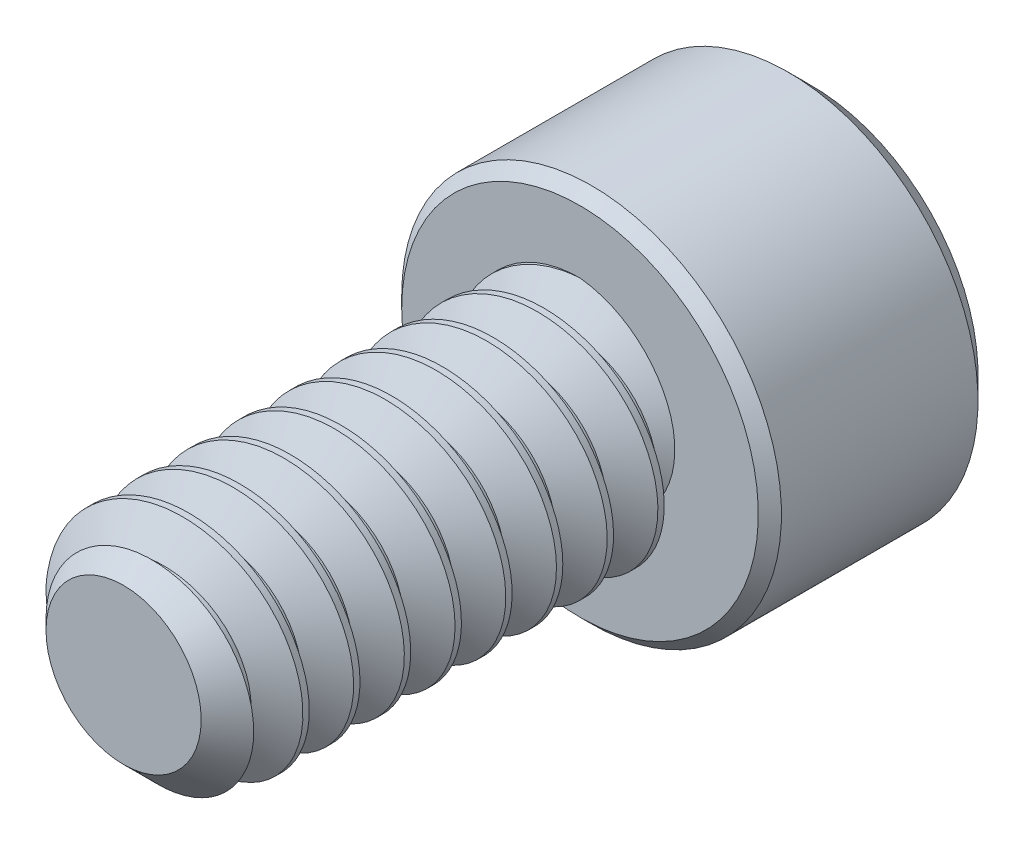
from build123d import *

# Parameters (mm, degrees)
SKETCH1_R          = 2.413
EXTRUDE1_DEPTH     = 9.525
CHAMFER3_SIZE      = 0.79375
CUT_SWEEP1_PITCH   = 1.058333333
SKETCH6_R          = 3.9624
EXTRUDE2_DEPTH     = 4.826
CUT_EXTRUDE1_DEPTH = 2.9765625
SKETCH8_R          = 2.291358881
CUT_EXTRUDE2_DEPTH = 0.4826
CUT_EXTRUDE2_DRAFT = -45
CHAMFER1_SIZE      = 0.4826
CHAMFER2_SIZE      = 0.2413


with BuildPart() as part:
    # Sketch1 → Extrude1 (new body)
    with BuildSketch(Plane.XY):
        Circle(SKETCH1_R)
    extrude(amount=-EXTRUDE1_DEPTH)

    # Chamfer3
    chamfer3_edges = [part.edges().sort_by_distance(p)[0] for p in [
        (-2.413, 0, 0),
    ]]
    chamfer(chamfer3_edges, length=CHAMFER3_SIZE)

    # Cut-Sweep1: the profile of Sketch3 profile screwed along a right-hand helix of 10 turns, 6 arcs to a turn; built about Z, then put on its axis
    cut_sweep1_z = Axis((0, 0, 0), (0, 0, 1))
    cut_sweep1_corners = [(2.4133, 0, -0.926214872), (1.725592336, 0, -0.529166667), (1.725592336, 0, -0.396875), (2.4133, 0, 0.000173205)]
    with BuildLine(mode=Mode.PRIVATE) as cut_sweep1_profile:
        Line(cut_sweep1_corners[0], cut_sweep1_corners[1])
        Line(cut_sweep1_corners[1], cut_sweep1_corners[2])
        Line(cut_sweep1_corners[2], cut_sweep1_corners[3])
        Line(cut_sweep1_corners[3], cut_sweep1_corners[0])
    cut_sweep1_cap = Face(cut_sweep1_profile.wire())
    cut_sweep1_turn_angles = [0, 30, 60, 90, 120, 150, 180, 210, 240, 270, 300, 330, 360]
    cut_sweep1_turn_weights = [1, 0.8660254037844387, 1, 0.8660254037844387, 1, 0.8660254037844387, 1, 0.8660254037844387, 1, 0.8660254037844387, 1, 0.8660254037844387, 1]
    cut_sweep1_turn_rails = [Edge.make_bspline([Vector(p[0], p[1], 0).rotate(cut_sweep1_z, cut_sweep1_turn_angles[k]) / cut_sweep1_turn_weights[k] + Vector(0, 0, p[2] + CUT_SWEEP1_PITCH * cut_sweep1_turn_angles[k] / 360) for k in range(13)], [0, 0, 0, 1, 1, 2, 2, 3, 3, 4, 4, 5, 5, 6, 6, 6], 2, cut_sweep1_turn_weights) for p in cut_sweep1_corners]
    cut_sweep1_turn_sides = [Face.make_surface_from_curves(cut_sweep1_turn_rails[p[0]], cut_sweep1_turn_rails[p[1]]) for p in [(0, 1), (1, 2), (2, 3), (3, 0)]]
    cut_sweep1 = Plane(origin=(0, 0, 0), x_dir=(0, 1, 0), z_dir=(0, 0, -1)) * Solid(Shell([*[p.moved(Location((0, 0, CUT_SWEEP1_PITCH * i))) for i in range(10) for p in cut_sweep1_turn_sides], cut_sweep1_cap, cut_sweep1_cap.rotate(cut_sweep1_z, 3600).moved(Location((0, 0, CUT_SWEEP1_PITCH * 3600 / 360)))]))
    add(cut_sweep1, mode=Mode.SUBTRACT)

    # Sketch6 → Extrude2 (add)
    with BuildSketch(Plane(origin=(0, 0, -9.525), x_dir=(-1, 0, 0), z_dir=(0, 0, -1))):
        Circle(SKETCH6_R)
    extrude(amount=EXTRUDE2_DEPTH)

    # Sketch7 → Cut-Extrude1 (cut)
    with BuildSketch(Plane(origin=(0, 0, -14.351), x_dir=(-1, 0, 0), z_dir=(0, 0, -1))):
        Polygon((0, 2.291358881), (-1.984375, 1.14567944), (-1.984375, -1.14567944), (0, -2.291358881), (1.984375, -1.14567944), (1.984375, 1.14567944), align=None)
    extrude(amount=-CUT_EXTRUDE1_DEPTH, mode=Mode.SUBTRACT)


with BuildPart() as cut_extrude2_tool:
    # Sketch8 → Cut-Extrude2 (with draft: the straight prism first)
    with BuildSketch(Plane(origin=(0, 0, -14.351), x_dir=(-1, 0, 0), z_dir=(0, 0, -1))):
        Circle(SKETCH8_R)
    extrude(amount=-CUT_EXTRUDE2_DEPTH)
    # Cut-Extrude2: the draft: its side faces are tilted about the plane it starts from
    cut_extrude2_sides = [cut_extrude2_tool.faces().sort_by_distance(p)[0] for p in [
        (2.291358881, 0, -14.1097),
    ]]
    draft(cut_extrude2_sides, Plane(origin=(0, 0, -14.351), x_dir=(-1, 0, 0), z_dir=(0, 0, -1)), CUT_EXTRUDE2_DRAFT)


with BuildPart() as part_1:
    add(part.part)

    # Cut-Extrude2: cut by cut_extrude2_tool
    add(cut_extrude2_tool.part, mode=Mode.SUBTRACT)

    # Chamfer1
    chamfer1_edges = [part_1.edges().sort_by_distance(p)[0] for p in [
        (3.9624, 0, -14.351),
    ]]
    chamfer(chamfer1_edges, length=CHAMFER1_SIZE)

    # Chamfer2
    chamfer2_edges = [part_1.edges().sort_by_distance(p)[0] for p in [
        (3.9624, 0, -9.525),
    ]]
    chamfer(chamfer2_edges, length=CHAMFER2_SIZE)


solid = part_1.part
